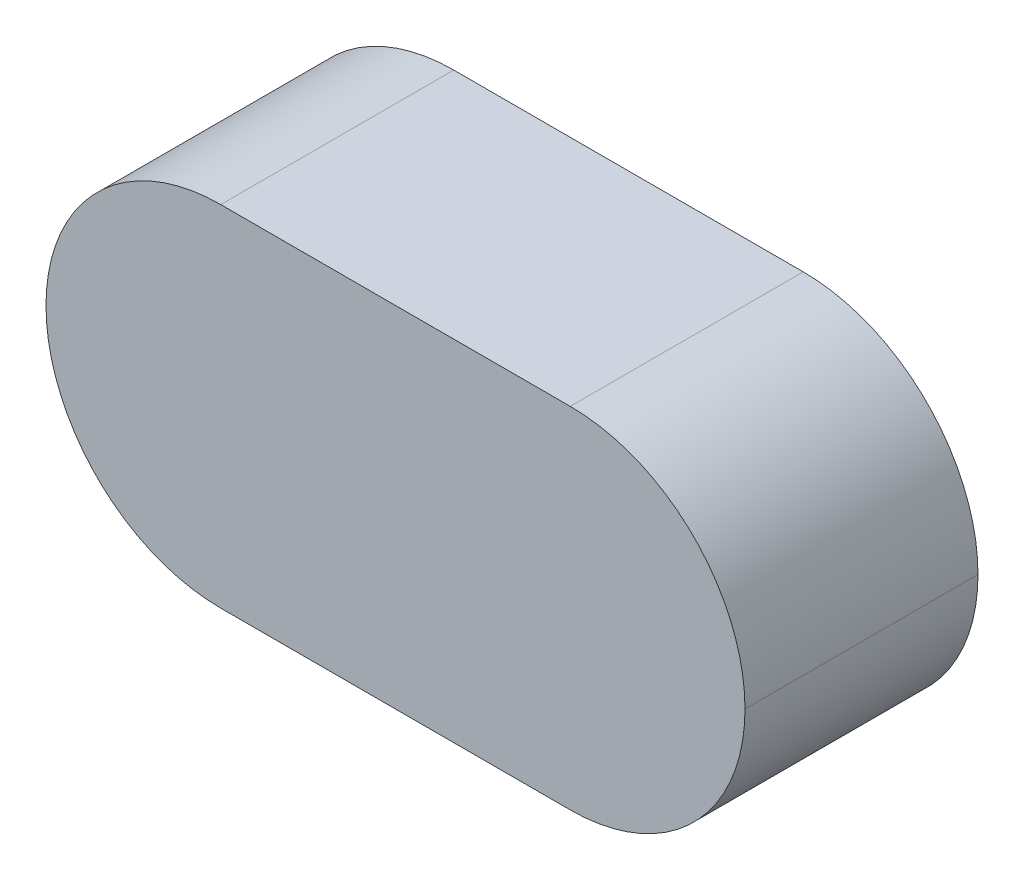
from build123d import *

# Parameters (mm, degrees)
SKETCH1_W           = 30
SKETCH1_H           = 15
BOSS_EXTRUDE1_DEPTH = 10
FILLET1_R           = 7.5


with BuildPart() as part:
    # Sketch1 → Boss-Extrude1 (new body)
    with BuildSketch(Plane.XY):
        with Locations((15, 7.5)):
            Rectangle(SKETCH1_W, SKETCH1_H)
    extrude(amount=BOSS_EXTRUDE1_DEPTH)

    # Fillet1
    fillet1_edges = [part.edges().sort_by_distance(p)[0] for p in [
        (30, 0, 5),
        (30, 15, 5),
        (0, 0, 5),
        (0, 15, 5),
    ]]
    fillet(fillet1_edges, radius=FILLET1_R - 0.0001)  # a hair under: the kernel refuses the full size


solid = part.part
